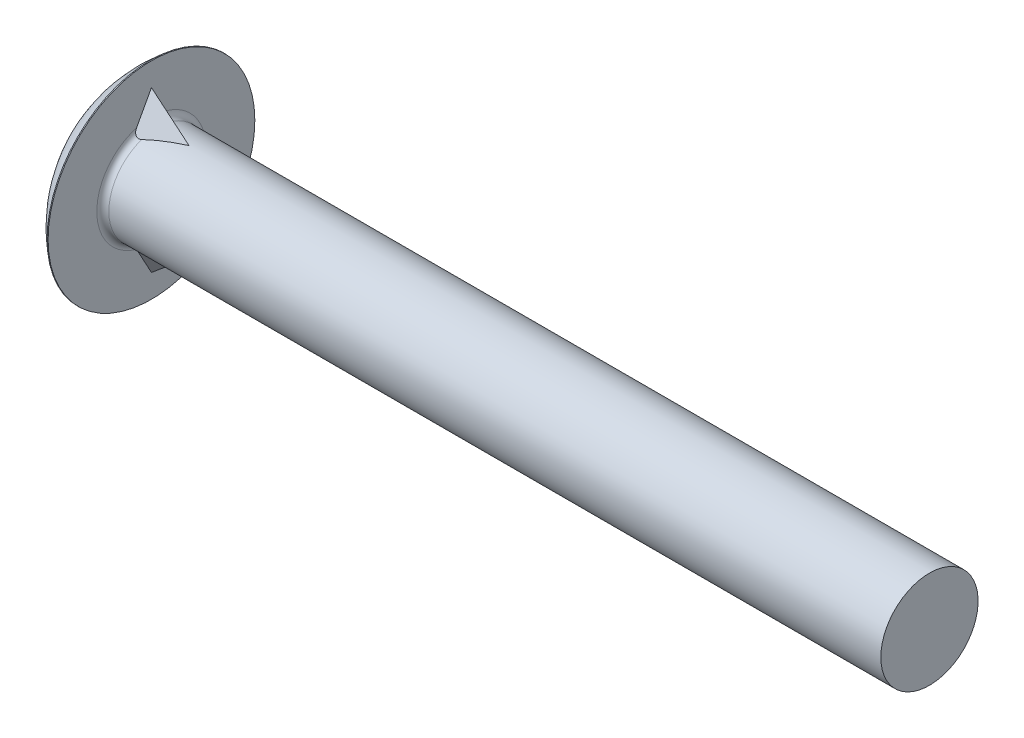
from build123d import *

# Parameters (mm, degrees)
CIRPATTERN1_COUNT = 2


with BuildPart() as part:
    # ThreadSchematic: read off the stored shape, not the designer's step
    # ThreadSchematic outline → ThreadSchematic (revolve)
    with BuildSketch(Plane.YX):
        with BuildLine():
            Line((0, 108.204), (0, 0))
            ThreePointArc((0, 0), (7.486725405, 1.703037349), (13.500100004, 6.477000005))
            Line((13.500100004, 6.477000005), (13.5001, 6.604))
            Line((13.5001, 6.604), (7.1374, 6.604))
            ThreePointArc((7.1374, 6.604), (6.58062412, 6.83462412), (6.35, 7.3914))
            Line((6.35, 7.3914), (6.35, 108.204))
            Line((6.35, 108.204), (0, 108.204))
        make_face()
    revolve(axis=Axis((0, 0, 0), (1, 0, 0)))

    # Boss-Sweep2: sweep along a path in Sketch3
    with BuildLine(Plane.XY) as boss_sweep2_path:
        Line((6.604, 10.4521), (11.5062, 6.35))
    # Sketch4 → Boss-Sweep2 (sweep)
    with BuildSketch(Plane(origin=(6.604, 0, 0), x_dir=(0, 0, -1), z_dir=(1, 0, 0))):
        Polygon((0, 10.4521), (-2.5146, 5.830890742), (2.5146, 5.830890742), align=None)
    boss_sweep2 = sweep(path=boss_sweep2_path.line)

    # CirPattern1: Boss-Sweep2 ×2 about axis
    cirpattern1_axis = Axis((0, 0, 0), (1, 0, 0))
    for i in range(1, CIRPATTERN1_COUNT):
        add(boss_sweep2.rotate(cirpattern1_axis, i * 360 / CIRPATTERN1_COUNT))


solid = part.part
